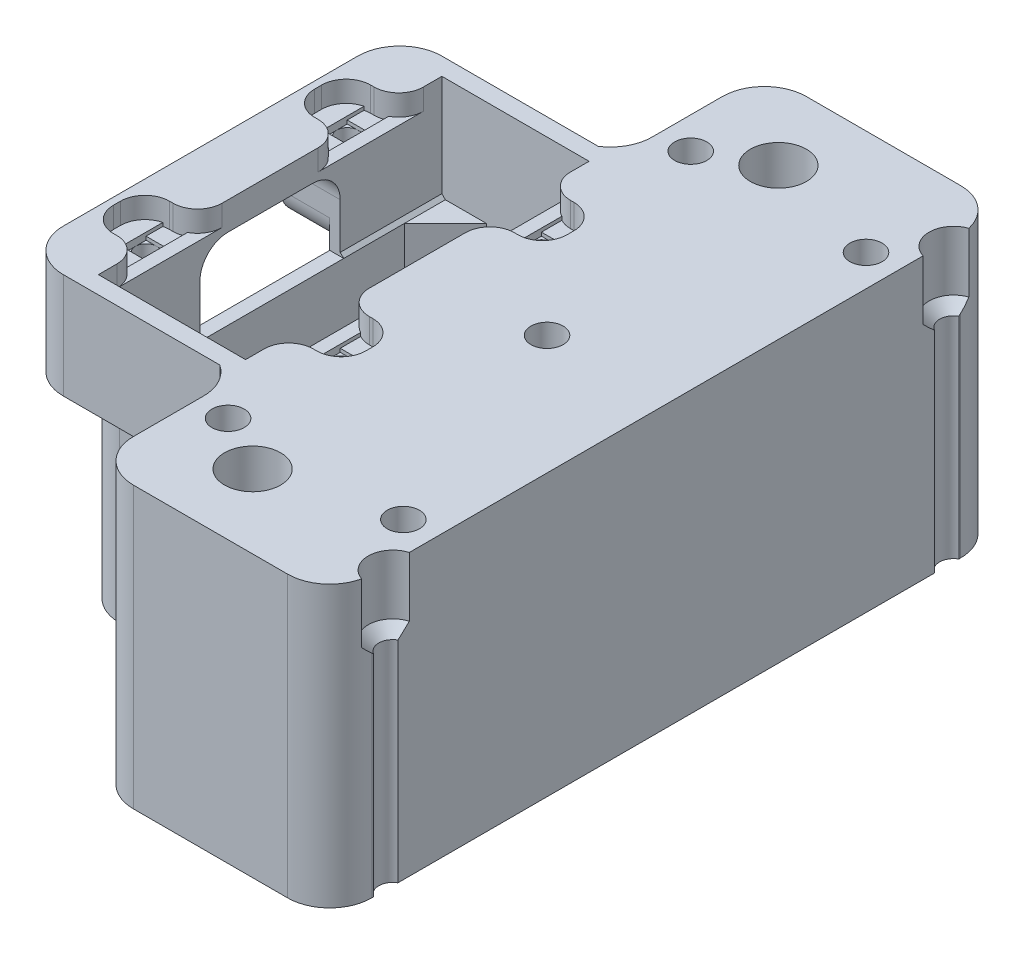
from build123d import *

# Parameters (mm, degrees)
SZKIC1_W                    = 24
SZKIC1_H                    = 52
DODANIE_WYCI_GNI_CIE1_DEPTH = 25
SZKIC2_W                    = 26
SZKIC2_H                    = 54
SZKIC2_W_2                  = 21
SZKIC2_H_2                  = 49
DODANIE_WYCI_GNI_CIE2_DEPTH = 12
SZKIC3_W                    = 38
SZKIC3_H                    = 54
SZKIC3_W_2                  = 21
SZKIC3_H_2                  = 49
DODANIE_WYCI_GNI_CIE3_DEPTH = 12
SZKIC4_W                    = 38
SZKIC4_H                    = 54
DODANIE_WYCI_GNI_CIE4_DEPTH = 3
ZAOKR_GLENIE1_R             = 3.5
SZKIC5_R                    = 1.5
WYTNIJ_WYCI_GNI_CIE1_DEPTH  = 8
WYTNIJ_WYCI_GNI_CIE2_REACH  = 63.425
SZKIC7_W                    = 20
SZKIC7_H                    = 11
SZKIC8_W                    = 34
SZKIC8_H                    = 96
SZKIC8_W_2                  = 30
SZKIC8_H_2                  = 92
DODANIE_WYCI_GNI_CIE5_DEPTH = 18.5
SZKIC9_W                    = 34
SZKIC9_H                    = 96
DODANIE_WYCI_GNI_CIE6_DEPTH = 3
SZKIC10_R                   = 1.9
WYTNIJ_WYCI_GNI_CIE3_DEPTH  = 70.873099259
ZAOKR_GLENIE2_R             = 5
SZKIC11_W                   = 34
SZKIC11_H                   = 96
SZKIC11_R                   = 4
DODANIE_WYCI_GNI_CIE7_DEPTH = 3.5
SZKIC12_R                   = 4
DODANIE_WYCI_GNI_CIE8_DEPTH = 15
SZKIC13_R                   = 2.3
WYTNIJ_WYCI_GNI_CIE4_DEPTH  = 6
WYTNIJ_WYCI_GNI_CIE5_DEPTH  = 72.028163428
SFAZOWANIE1_SIZE            = 0.5
SZKIC15_W                   = 3
SZKIC15_H                   = 3
WYTNIJ_WYCI_GNI_CIE6_DEPTH  = 1
WYTNIJ_WYCI_GNI_CIE7_DEPTH  = 0.5
SFAZOWANIE2_SIZE            = 2.1
ZAOKR_GLENIE3_R             = 6
ZAOKR_GLENIE4_R             = 4
SZKIC18_R                   = 3.5
WYTNIJ_WYCI_GNI_CIE8_DEPTH  = 10
SFAZOWANIE3_SIZE            = 1.5
SZKIC19_R                   = 2
WYTNIJ_WYCI_GNI_CIE9_DEPTH  = 73.938330286


with BuildPart() as part:
    # Szkic1 → Dodanie-wyciągnięcie1 (new body)
    with BuildSketch(Plane(origin=(0, 0, 0), x_dir=(1, 0, 0), z_dir=(0, 1, 0))):
        Rectangle(SZKIC1_W, SZKIC1_H)
        with BuildLine():
            Line((10, 14.5), (10, -14.5))
            ThreePointArc((10, -14.5), (0, -24.5), (-10, -14.5))
            Line((-10, -14.5), (-10, 14.5))
            ThreePointArc((-10, 14.5), (0, 24.5), (10, 14.5))
        make_face(mode=Mode.SUBTRACT)
    extrude(amount=DODANIE_WYCI_GNI_CIE1_DEPTH)

    # Szkic2 → Dodanie-wyciągnięcie2 (add)
    with BuildSketch(Plane(origin=(0, 25, 0), x_dir=(1, 0, 0), z_dir=(0, 1, 0))):
        Rectangle(SZKIC2_W, SZKIC2_H)
        Rectangle(SZKIC2_W_2, SZKIC2_H_2, mode=Mode.SUBTRACT)
    extrude(amount=DODANIE_WYCI_GNI_CIE2_DEPTH)

    # Szkic3 → Dodanie-wyciągnięcie3 (add)
    with BuildSketch(Plane(origin=(0, 37, 0), x_dir=(1, 0, 0), z_dir=(0, 1, 0))):
        Rectangle(SZKIC3_W, SZKIC3_H)
        Rectangle(SZKIC3_W_2, SZKIC3_H_2, mode=Mode.SUBTRACT)
    extrude(amount=-DODANIE_WYCI_GNI_CIE3_DEPTH)

    # Szkic4 → Dodanie-wyciągnięcie4 (add)
    with BuildSketch(Plane(origin=(0, 37, 0), x_dir=(1, 0, 0), z_dir=(0, 1, 0))):
        Rectangle(SZKIC4_W, SZKIC4_H)
        Polygon((-10, 24.5), (10, 24.5), (10.5, 24.5), (10.5, 18.35), (18, 18.35), (18, 10.35), (10.5, 10.35), (10.5, -10.35), (18, -10.35), (18, -18.35), (10.5, -18.35), (10.5, -24.5), (10, -24.5), (-10, -24.5), (-10.5, -24.5), (-10.5, -18.35), (-18, -18.35), (-18, -10.35), (-10.5, -10.35), (-10.5, 10.35), (-18, 10.35), (-18, 18.35), (-10.5, 18.35), (-10.5, 24.5), align=None, mode=Mode.SUBTRACT)
    extrude(amount=DODANIE_WYCI_GNI_CIE4_DEPTH)

    # Zaokrąglenie1
    zaokr_glenie1_edges = [part.edges().sort_by_distance(p)[0] for p in [
        (18, 38.5, -10.35),
        (10.5, 38.5, -10.35),
        (10.5, 38.5, 10.35),
        (18, 38.5, 10.35),
        (18, 38.5, 18.35),
        (10.5, 38.5, 18.35),
        (-10.5, 38.5, 18.35),
        (-18, 38.5, 18.35),
        (-18, 38.5, 10.35),
        (-10.5, 38.5, 10.35),
        (-10.5, 38.5, -10.35),
        (-18, 38.5, -10.35),
        (-18, 38.5, -18.35),
        (-10.5, 38.5, -18.35),
        (10.5, 38.5, -18.35),
        (18, 38.5, -18.35),
    ]]
    fillet(zaokr_glenie1_edges, radius=ZAOKR_GLENIE1_R)

    # Szkic5 → Wytnij-wyciągnięcie1 (cut)
    with BuildSketch(Plane(origin=(0, 37, 0), x_dir=(1, 0, 0), z_dir=(0, 1, 0))):
        with Locations(Location((13.85, -14.35, 0), (0, 0, 270))):
            Circle(SZKIC5_R)
        with Locations(Location((13.85, 14.35, 0), (0, 0, 270))):
            Circle(SZKIC5_R)
        with Locations(Location((-13.85, -14.35, 0), (0, 0, 90))):
            Circle(SZKIC5_R)
        with Locations(Location((-13.85, 14.35, 0), (0, 0, 90))):
            Circle(SZKIC5_R)
    extrude(amount=-WYTNIJ_WYCI_GNI_CIE1_DEPTH, mode=Mode.SUBTRACT)

    # Szkic7 → Wytnij-wyciągnięcie2 (cut, up to next)
    with BuildSketch(Plane.ZY.offset(19), mode=Mode.PRIVATE) as wytnij_wyci_gni_cie2_sk1:
        with Locations((0, 30.5)):
            Rectangle(SZKIC7_W, SZKIC7_H)
    wytnij_wyci_gni_cie2_tool1 = extrude(wytnij_wyci_gni_cie2_sk1.sketch, amount=-WYTNIJ_WYCI_GNI_CIE2_REACH, mode=Mode.PRIVATE) & part.part
    add(wytnij_wyci_gni_cie2_tool1.solids().sort_by_distance((-19, 30.5, 0))[0], mode=Mode.SUBTRACT)

    # Szkic8 → Dodanie-wyciągnięcie5 (add)
    with BuildSketch(Plane(origin=(0, 0, 0), x_dir=(1, 0, 0), z_dir=(0, 1, 0))):
        with Locations((29, 0)):
            Rectangle(SZKIC8_W, SZKIC8_H)
        with Locations((29, 0)):
            Rectangle(SZKIC8_W_2, SZKIC8_H_2, mode=Mode.SUBTRACT)
    extrude(amount=DODANIE_WYCI_GNI_CIE5_DEPTH)

    # Szkic9 → Dodanie-wyciągnięcie6 (add)
    with BuildSketch(Plane(origin=(0, 18.5, 0), x_dir=(1, 0, 0), z_dir=(0, 1, 0))):
        with Locations((29, 0)):
            Rectangle(SZKIC9_W, SZKIC9_H)
    extrude(amount=DODANIE_WYCI_GNI_CIE6_DEPTH)

    # Szkic10 → Wytnij-wyciągnięcie3 (cut, through all)
    with BuildSketch(Plane(origin=(0, 21.5, 0), x_dir=(1, 0, 0), z_dir=(0, 1, 0))):
        with Locations(Location((24.5, 37.5, 0), (0, 0, 270))):
            Circle(SZKIC10_R)
        with Locations(Location((24.5, -37.5, 0), (0, 0, 270))):
            Circle(SZKIC10_R)
    extrude(amount=-WYTNIJ_WYCI_GNI_CIE3_DEPTH, mode=Mode.SUBTRACT)

    # Zaokrąglenie2
    zaokr_glenie2_edges = [part.edges().sort_by_distance(p)[0] for p in [
        (44, 9.25, -46),
        (14, 9.25, -46),
        (14, 9.25, 46),
        (44, 9.25, 46),
    ]]
    fillet(zaokr_glenie2_edges, radius=ZAOKR_GLENIE2_R)

    # Szkic11 → Dodanie-wyciągnięcie7 (add)
    with BuildSketch(Plane(origin=(0, 21.5, 0), x_dir=(1, 0, 0), z_dir=(0, 1, 0))):
        with Locations((29, 0)):
            Rectangle(SZKIC11_W, SZKIC11_H)
        with Locations(Location((24.5, 37.5, 0), (0, 0, 90))):
            Circle(SZKIC11_R, mode=Mode.SUBTRACT)
        with Locations(Location((24.5, -37.5, 0), (0, 0, 90))):
            Circle(SZKIC11_R, mode=Mode.SUBTRACT)
    extrude(amount=DODANIE_WYCI_GNI_CIE7_DEPTH)

    # Szkic12 → Dodanie-wyciągnięcie8 (add)
    with BuildSketch(Plane(origin=(0, 25, 0), x_dir=(1, 0, 0), z_dir=(0, 1, 0))):
        Polygon((12, 48), (12, 27), (19, 27), (19, -27), (12, -27), (12, -48), (46, -48), (46, 48), align=None)
        with Locations(Location((24.5, -37.5, 0), (0, 0, 90))):
            Circle(SZKIC12_R, mode=Mode.SUBTRACT)
        with Locations(Location((24.5, 37.5, 0), (0, 0, 90))):
            Circle(SZKIC12_R, mode=Mode.SUBTRACT)
    extrude(amount=DODANIE_WYCI_GNI_CIE8_DEPTH)

    # Szkic13 → Wytnij-wyciągnięcie4 (cut)
    with BuildSketch(Plane(origin=(0, 40, 0), x_dir=(1, 0, 0), z_dir=(0, 1, 0))):
        with Locations(Location((41.5, 33, 0), (0, 0, 270))):
            Circle(SZKIC13_R)
        with Locations(Location((41.5, -33, 0), (0, 0, 270))):
            Circle(SZKIC13_R)
        with Locations(Location((16.5, -33, 0), (0, 0, 90))):
            Circle(SZKIC13_R)
        with Locations(Location((16.5, 33, 0), (0, 0, 90))):
            Circle(SZKIC13_R)
        with Locations(Location((29, 0, 0), (0, 0, 270))):
            Circle(SZKIC13_R)
    extrude(amount=-WYTNIJ_WYCI_GNI_CIE4_DEPTH, mode=Mode.SUBTRACT)

    # Szkic14 → Wytnij-wyciągnięcie5 (cut, through all)
    with BuildSketch(Plane(origin=(0, 25, 0), x_dir=(1, 0, 0), z_dir=(0, 1, 0))):
        Polygon((10, 0), (10, 18.642135624), (4.142135624, 24.5), (-4.142135624, 24.5), (-10, 18.642135624), (-10, 0), (-10, -18.642135624), (-4.142135624, -24.5), (4.142135624, -24.5), (10, -18.642135624), align=None)
    extrude(amount=-WYTNIJ_WYCI_GNI_CIE5_DEPTH, mode=Mode.SUBTRACT)

    # Sfazowanie1
    sfazowanie1_edges = [part.edges().sort_by_distance(p)[0] for p in [
        (-10.5, 25, 17.25),
        (10.5, 25, 0),
        (-10.5, 25, -17.25),
    ]]
    chamfer(sfazowanie1_edges, length=SFAZOWANIE1_SIZE - 0.0001)  # a hair under: the kernel refuses the full size

    # Szkic15 → Wytnij-wyciągnięcie6 (cut)
    with BuildSketch(Plane(origin=(0, 37, 0), x_dir=(1, 0, 0), z_dir=(0, 1, 0))):
        with Locations((13.85, -14.35)):
            Rectangle(SZKIC15_W, SZKIC15_H)
        with Locations((13.85, 14.35)):
            Rectangle(SZKIC15_W, SZKIC15_H)
        with Locations((-13.85, 14.35)):
            Rectangle(SZKIC15_W, SZKIC15_H)
        with Locations((-13.85, -14.35)):
            Rectangle(SZKIC15_W, SZKIC15_H)
    extrude(amount=-WYTNIJ_WYCI_GNI_CIE6_DEPTH, mode=Mode.SUBTRACT)

    # Szkic16 → Wytnij-wyciągnięcie7 (cut)
    with BuildSketch(Plane(origin=(0, 37, 0), x_dir=(1, 0, 0), z_dir=(0, 1, 0))):
        with BuildLine():
            Line((-15.35, -18.245217224), (-15.35, -10.454782776))
            ThreePointArc((-15.35, -10.454782776), (-14.928217068, -10.376294465), (-14.5, -10.35))
            Line((-14.5, -10.35), (-14, -10.35))
            ThreePointArc((-14, -10.35), (-13.149508093, -10.245094037), (-12.35, -9.936664867))
            Line((-12.35, -9.936664867), (-12.35, -18.763335133))
            ThreePointArc((-12.35, -18.763335133), (-13.149508093, -18.454905963), (-14, -18.35))
            Line((-14, -18.35), (-14.5, -18.35))
            ThreePointArc((-14.5, -18.35), (-14.928217068, -18.323705535), (-15.35, -18.245217224))
        make_face()
        with BuildLine():
            Line((-14.5, 18.35), (-14, 18.35))
            ThreePointArc((-14, 18.35), (-13.149508093, 18.454905963), (-12.35, 18.763335133))
            Line((-12.35, 18.763335133), (-12.35, 9.936664867))
            ThreePointArc((-12.35, 9.936664867), (-13.149508093, 10.245094037), (-14, 10.35))
            Line((-14, 10.35), (-14.5, 10.35))
            ThreePointArc((-14.5, 10.35), (-14.928217068, 10.376294465), (-15.35, 10.454782776))
            Line((-15.35, 10.454782776), (-15.35, 18.245217224))
            ThreePointArc((-15.35, 18.245217224), (-14.928217068, 18.323705535), (-14.5, 18.35))
        make_face()
    wytnij_wyci_gni_cie7 = extrude(amount=-WYTNIJ_WYCI_GNI_CIE7_DEPTH, mode=Mode.SUBTRACT)

    # Lustro1: Wytnij-wyciągnięcie7 across plane
    add(wytnij_wyci_gni_cie7.mirror(Plane(origin=(0, 0, 0), x_dir=(0, 0, 1), z_dir=(1, 0, 0))), mode=Mode.SUBTRACT)

    # Sfazowanie2
    sfazowanie2_edges = [part.edges().sort_by_distance(p)[0] for p in [
        (24.5, 21.5, -33.5),
        (24.5, 21.5, 41.5),
    ]]
    chamfer(sfazowanie2_edges, length=SFAZOWANIE2_SIZE - 0.0001)  # a hair under: the kernel refuses the full size

    # Zaokrąglenie3
    zaokr_glenie3_edges = [part.edges().sort_by_distance(p)[0] for p in [
        (12, 12.5, 26),
        (12, 12.5, -26),
        (-19, 32.5, 27),
        (-19, 32.5, -27),
        (-12, 12.5, -26),
        (-12, 12.5, 26),
        (12, 20, -48),
        (46, 20, -48),
        (46, 20, 48),
        (12, 20, 48),
    ]]
    fillet(zaokr_glenie3_edges, radius=ZAOKR_GLENIE3_R)

    # Zaokrąglenie4
    zaokr_glenie4_edges = [part.edges().sort_by_distance(p)[0] for p in [
        (-15.5, 25, 10),
        (-14.75, 36, 10),
        (-15.5, 25, -10),
        (-14.75, 36, -10),
    ]]
    fillet(zaokr_glenie4_edges, radius=ZAOKR_GLENIE4_R)

    # Szkic18 → Wytnij-wyciągnięcie8 (cut)
    with BuildSketch(Plane(origin=(0, 40, 0), x_dir=(1, 0, 0), z_dir=(0, 1, 0))):
        with Locations((47, 40)):
            Circle(SZKIC18_R)
        with Locations((47, -40)):
            Circle(SZKIC18_R)
    extrude(amount=-WYTNIJ_WYCI_GNI_CIE8_DEPTH, mode=Mode.SUBTRACT)

    # Sfazowanie3
    sfazowanie3_edges = [part.edges().sort_by_distance(p)[0] for p in [
        (43.500820064, 30, -39.924238715),
        (43.500820064, 30, 39.924238715),
    ]]
    chamfer(sfazowanie3_edges, length=SFAZOWANIE3_SIZE)

    # Szkic19 → Wytnij-wyciągnięcie9 (cut, through all)
    with BuildSketch(Plane(origin=(0, 30, 0), x_dir=(1, 0, 0), z_dir=(0, 1, 0))):
        with Locations((47, -40)):
            Circle(SZKIC19_R)
        with Locations((47, 40)):
            Circle(SZKIC19_R)
    extrude(amount=-WYTNIJ_WYCI_GNI_CIE9_DEPTH, mode=Mode.SUBTRACT)


solid = part.part
